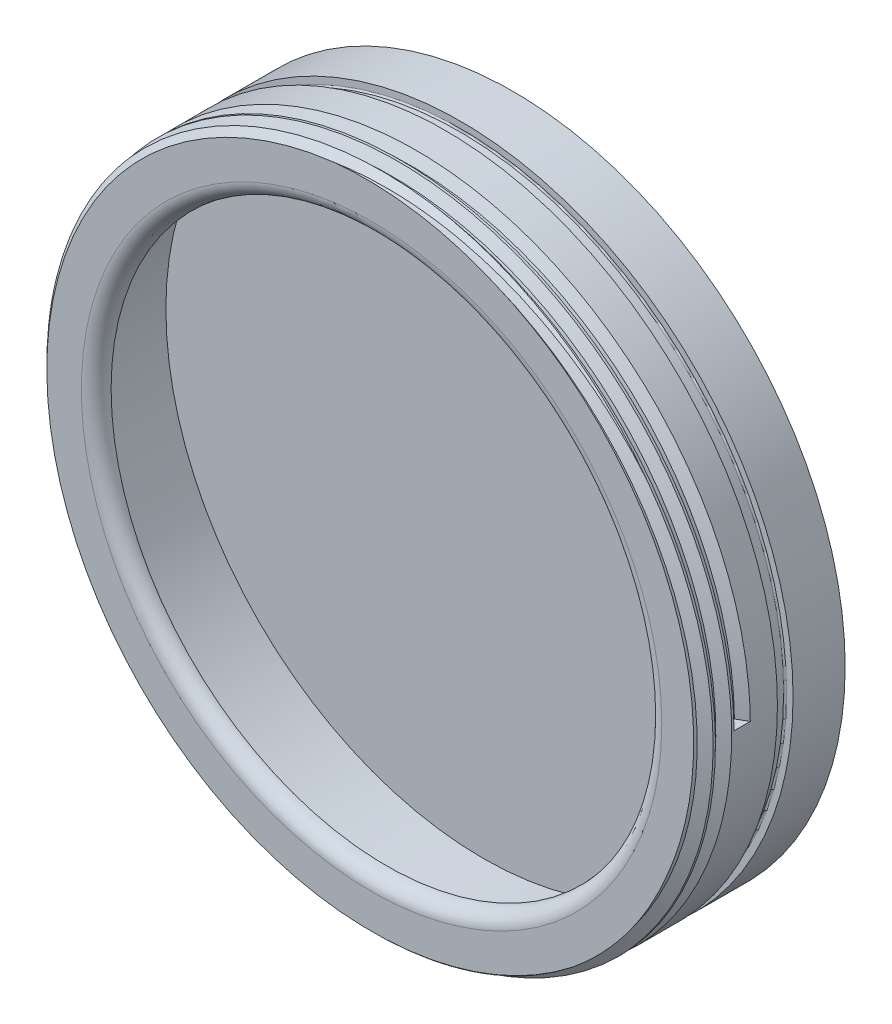
from build123d import *

# Parameters (mm, degrees)
SKETCH1_R                = 56.6928
SKETCH1_R_2              = 54.1528
BOSS_EXTRUDE1_DEPTH      = 6.35
SKETCH3_R                = 55.3339
SKETCH3_R_2              = 54.1528
BOSS_EXTRUDE2_DEPTH      = 2.667
SKETCH4_R                = 56.6928
SKETCH4_R_2              = 54.1528
BOSS_EXTRUDE3_DEPTH      = 10.033
SKETCH18_R               = 56.6928
SKETCH18_R_2             = 46.99
BOSS_EXTRUDE4_DEPTH      = 2.54
FILLET1_R                = 0.254
THREAD1_PITCH            = 3.175
FILLET2_R                = 2.54
BOSS_EXTRUDE5_DEPTH      = 2.54
BOSS_EXTRUDE5_DEPTH_BACK = 2.54
SKETCH19_R               = 56.6928


with BuildPart() as part:
    # Sketch1 → Boss-Extrude1 (new body)
    with BuildSketch(Plane.XY):
        with Locations((-54.462846348, 14.706120018)):
            Circle(SKETCH1_R)
        with Locations((-54.462846348, 14.706120018)):
            Circle(SKETCH1_R_2, mode=Mode.SUBTRACT)
    extrude(amount=BOSS_EXTRUDE1_DEPTH)

    # Sketch3 → Boss-Extrude2 (add)
    with BuildSketch(Plane.XY.offset(6.35)):
        with Locations((-54.462846348, 14.706120018)):
            Circle(SKETCH3_R)
        with Locations((-54.462846348, 14.706120018)):
            Circle(SKETCH3_R_2, mode=Mode.SUBTRACT)
    extrude(amount=BOSS_EXTRUDE2_DEPTH)

    # Sketch4 → Boss-Extrude3 (add)
    with BuildSketch(Plane.XY.offset(9.017)):
        with Locations((-54.462846348, 14.706120018)):
            Circle(SKETCH4_R)
        with Locations((-54.462846348, 14.706120018)):
            Circle(SKETCH4_R_2, mode=Mode.SUBTRACT)
    extrude(amount=BOSS_EXTRUDE3_DEPTH)

    # Sketch18 → Boss-Extrude4 (add)
    with BuildSketch(Plane.XY.offset(19.05)):
        with Locations((-54.462846348, 14.706120018)):
            Circle(SKETCH18_R)
        with Locations((-54.462846348, 14.706120018)):
            Circle(SKETCH18_R_2, mode=Mode.SUBTRACT)
    extrude(amount=BOSS_EXTRUDE4_DEPTH)

    # Fillet1
    fillet1_edges = [part.edges().sort_by_distance(p)[0] for p in [
        (-109.796746348, 14.706120018, 9.017),
        (-109.796746348, 14.706120018, 6.35),
    ]]
    fillet(fillet1_edges, radius=FILLET1_R)

    # Thread1: arcs per turn and ends read off the stored shape
    # Thread1: the profile of Thread Profile2 profile screwed along a right-hand helix through 2.5 turns, 12 arcs to a turn; built about Z, then put on its axis
    thread1_z = Axis((0, 0, 0), (0, 0, 1))
    thread1_corners = [(-56.6931, 0, -7.937673205), (-56.6931, 0, -5.159201804), (-54.974280846, 0, -6.151562504), (-54.974280846, 0, -6.945312504)]
    with BuildLine(mode=Mode.PRIVATE) as thread1_profile:
        Line(thread1_corners[0], thread1_corners[1])
        Line(thread1_corners[1], thread1_corners[2])
        Line(thread1_corners[2], thread1_corners[3])
        Line(thread1_corners[3], thread1_corners[0])
    thread1_cap = Face(thread1_profile.wire())
    thread1_turn_angles = [0, 15, 30, 45, 60, 75, 90, 105, 120, 135, 150, 165, 180, 195, 210, 225, 240, 255, 270, 285, 300, 315, 330, 345, 360]
    thread1_turn_weights = [1, 0.9659258262890683, 1, 0.9659258262890683, 1, 0.9659258262890683, 1, 0.9659258262890683, 1, 0.9659258262890683, 1, 0.9659258262890683, 1, 0.9659258262890683, 1, 0.9659258262890683, 1, 0.9659258262890683, 1, 0.9659258262890683, 1, 0.9659258262890683, 1, 0.9659258262890683, 1]
    thread1_turn_rails = [Edge.make_bspline([Vector(p[0], p[1], 0).rotate(thread1_z, thread1_turn_angles[k]) / thread1_turn_weights[k] + Vector(0, 0, p[2] + THREAD1_PITCH * thread1_turn_angles[k] / 360) for k in range(25)], [0, 0, 0, 1, 1, 2, 2, 3, 3, 4, 4, 5, 5, 6, 6, 7, 7, 8, 8, 9, 9, 10, 10, 11, 11, 12, 12, 12], 2, thread1_turn_weights) for p in thread1_corners]
    thread1_turn_sides = [Face.make_surface_from_curves(thread1_turn_rails[p[0]], thread1_turn_rails[p[1]]) for p in [(0, 1), (1, 2), (2, 3), (3, 0)]]
    thread1_last_angles = [720, 735, 750, 765, 780, 795, 810, 825, 840, 855, 870, 885, 900]
    thread1_last_weights = [1, 0.9659258262890683, 1, 0.9659258262890683, 1, 0.9659258262890683, 1, 0.9659258262890683, 1, 0.9659258262890683, 1, 0.9659258262890683, 1]
    thread1_last_rails = [Edge.make_bspline([Vector(p[0], p[1], 0).rotate(thread1_z, thread1_last_angles[k]) / thread1_last_weights[k] + Vector(0, 0, p[2] + THREAD1_PITCH * thread1_last_angles[k] / 360) for k in range(13)], [0, 0, 0, 1, 1, 2, 2, 3, 3, 4, 4, 5, 5, 6, 6, 6], 2, thread1_last_weights) for p in thread1_corners]
    thread1_last_sides = [Face.make_surface_from_curves(thread1_last_rails[p[0]], thread1_last_rails[p[1]]) for p in [(0, 1), (1, 2), (2, 3), (3, 0)]]
    thread1 = Plane(origin=(-54.462846348, 14.706120018, 21.59), x_dir=(-1, 0, 0), z_dir=(0, 0, 1)) * Solid(Shell([*[p.moved(Location((0, 0, THREAD1_PITCH * i))) for i in range(2) for p in thread1_turn_sides], *thread1_last_sides, thread1_cap, thread1_cap.rotate(thread1_z, 900).moved(Location((0, 0, THREAD1_PITCH * 900 / 360)))]))
    add(thread1, mode=Mode.SUBTRACT)

    # Chamfer1: read off the stored shape, not the designer's step
    # Chamfer1 outline → Chamfer1 (revolve, cut)
    with BuildSketch(Plane(origin=(-54.462846348, 14.706120018, 0), x_dir=(1, 0, 0), z_dir=(0, -1, 0))):
        Polygon((56.6928, 21.59), (55.4228, 21.59), (56.6928, 20.32), align=None)
    revolve(axis=Axis((-54.462846348, 14.706120018, 0), (0, 0, 1)), mode=Mode.SUBTRACT)

    # Fillet2
    fillet2_edges = [part.edges().sort_by_distance(p)[0] for p in [
        (-101.452846348, 14.706120018, 21.59),
    ]]
    fillet(fillet2_edges, radius=FILLET2_R - 0.0001)  # a hair under: the kernel refuses the full size

    # Sketch19 → Boss-Extrude5 (add, two sides: drawn at the far end of the back side and taken through both)
    with BuildSketch(Plane.XY.offset(-BOSS_EXTRUDE5_DEPTH_BACK)):
        with Locations((-54.462846348, 14.706120018)):
            Circle(SKETCH19_R)
    extrude(amount=BOSS_EXTRUDE5_DEPTH + BOSS_EXTRUDE5_DEPTH_BACK)


solid = part.part
